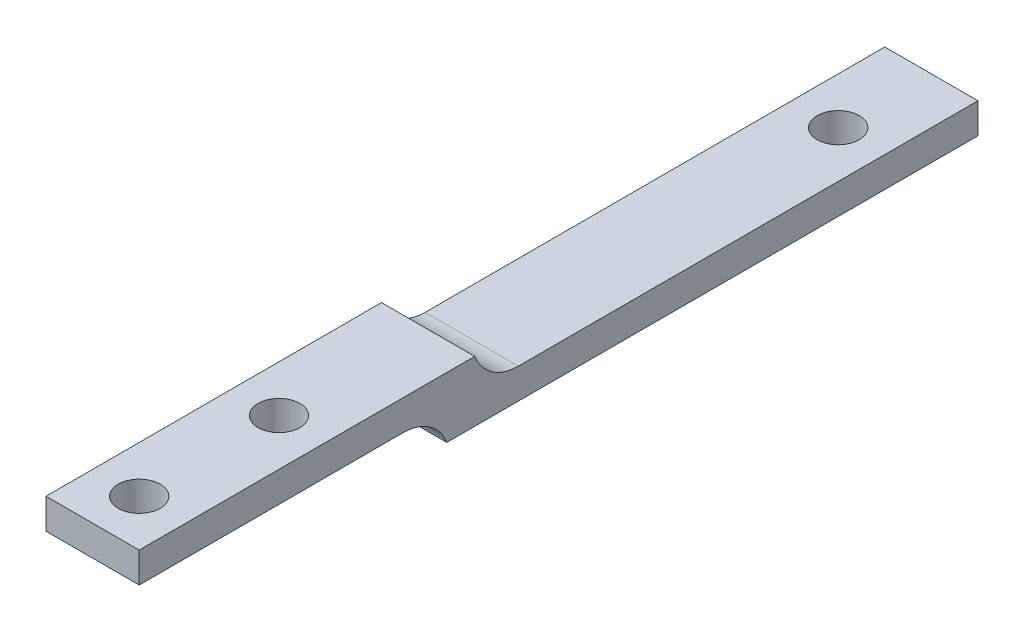
from build123d import *

# Parameters (mm, degrees)
SKETCH1_R               = 2.25
BOSS_EXTRUDE1_DEPTH     = 6.5
CUT_EXTRUDE1_DEPTH      = 5
CUT_EXTRUDE1_DEPTH_BACK = 5
SKETCH2_W               = 33
SKETCH2_H               = 3.25
SKETCH2_W_2             = 54
FILLET1_R               = 5


with BuildPart() as part:
    # Sketch1 → Boss-Extrude1 (new body)
    with BuildSketch(Plane(origin=(0, 0, 0), x_dir=(1, 0, 0), z_dir=(0, 1, 0))):
        Polygon((0, 0), (-5, 0), (-5, 90), (5, 90), (5, 0), align=None)
        with Locations(Location((0, 20, 0), (0, 0, 90))):
            Circle(SKETCH1_R, mode=Mode.SUBTRACT)
        with Locations(Location((0, 5, 0), (0, 0, 90))):
            Circle(SKETCH1_R, mode=Mode.SUBTRACT)
        with Locations(Location((0, 80, 0), (0, 0, 90))):
            Circle(SKETCH1_R, mode=Mode.SUBTRACT)
    extrude(amount=BOSS_EXTRUDE1_DEPTH)

    # Sketch2 → Cut-Extrude1 (cut, two sides: drawn at the far end of the back side and taken through both)
    with BuildSketch(Plane(origin=(0, 0, 0), x_dir=(0, 0, -1), z_dir=(1, 0, 0)).offset(-CUT_EXTRUDE1_DEPTH_BACK)):
        with Locations((16.5, 1.625)):
            Rectangle(SKETCH2_W, SKETCH2_H)
        with Locations((63, 4.875)):
            Rectangle(SKETCH2_W_2, SKETCH2_H)
    extrude(amount=CUT_EXTRUDE1_DEPTH + CUT_EXTRUDE1_DEPTH_BACK, mode=Mode.SUBTRACT)

    # Fillet1
    # the kernel refuses this fillet: 5 mm, written as the material it adds along each edge
    with BuildSketch(Plane(origin=(5, 3.25, -33), x_dir=(0, 0, 1), z_dir=(-1, 0, 0))) as fillet1_piece_1:
        with BuildLine():
            CenterArc((4.683748499, -5), FILLET1_R, 90, 69.512684885)
            Line((0, -3.25), (-0.09367497, -3.215))
            ThreePointArc((-0.09367497, -3.215), (-0.1, -1.625), (-0.1, 0))
            Line((-0.1, 0), (0, 0.1))
            Line((0, 0.1), (4.683748499, 0.1))
            Line((4.683748499, 0.1), (4.683748499, 0))
        make_face()
    extrude(amount=10)
    with BuildSketch(Plane(origin=(-5, 3.25, -36), x_dir=(0, 0, -1), z_dir=(1, 0, 0))) as fillet1_piece_2:
        with BuildLine():
            CenterArc((4.683748499, 5), FILLET1_R, 200.487315115, 69.512684885)
            Line((0, 3.25), (-0.09367497, 3.215))
            ThreePointArc((-0.09367497, 3.215), (-0.1, 1.625), (-0.1, 0))
            Line((-0.1, 0), (0, -0.1))
            Line((0, -0.1), (4.683748499, -0.1))
            Line((4.683748499, -0.1), (4.683748499, 0))
        make_face()
    extrude(amount=10)


solid = part.part
